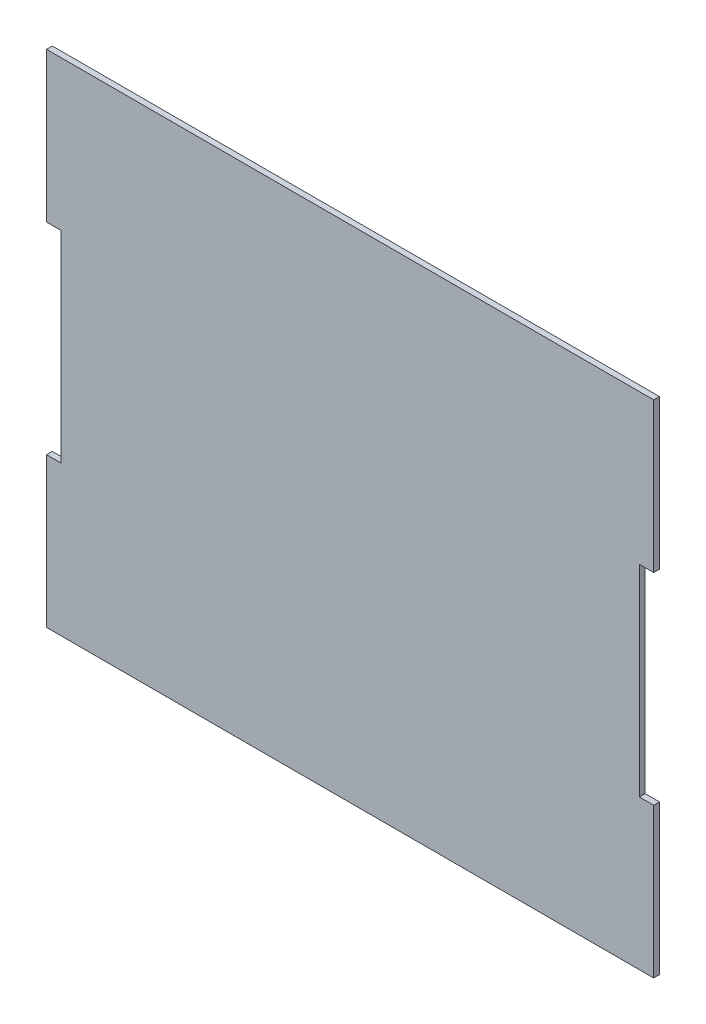
from build123d import *

# Parameters (mm, degrees)
EXTRUDE_1_DEPTH = 2


with BuildPart() as part:
    # 草图1 → 凸台-拉伸1 (new body)
    with BuildSketch(Plane.XY):
        Polygon((105.5, 35), (105.5, 87), (-105.5, 87), (-105.5, 35), (-100.5, 35), (-100.5, -35), (-105.5, -35), (-105.5, -87), (105.5, -87), (105.5, -35), (100.5, -35), (100.5, 35), align=None)
    extrude(amount=EXTRUDE_1_DEPTH)


solid = part.part
